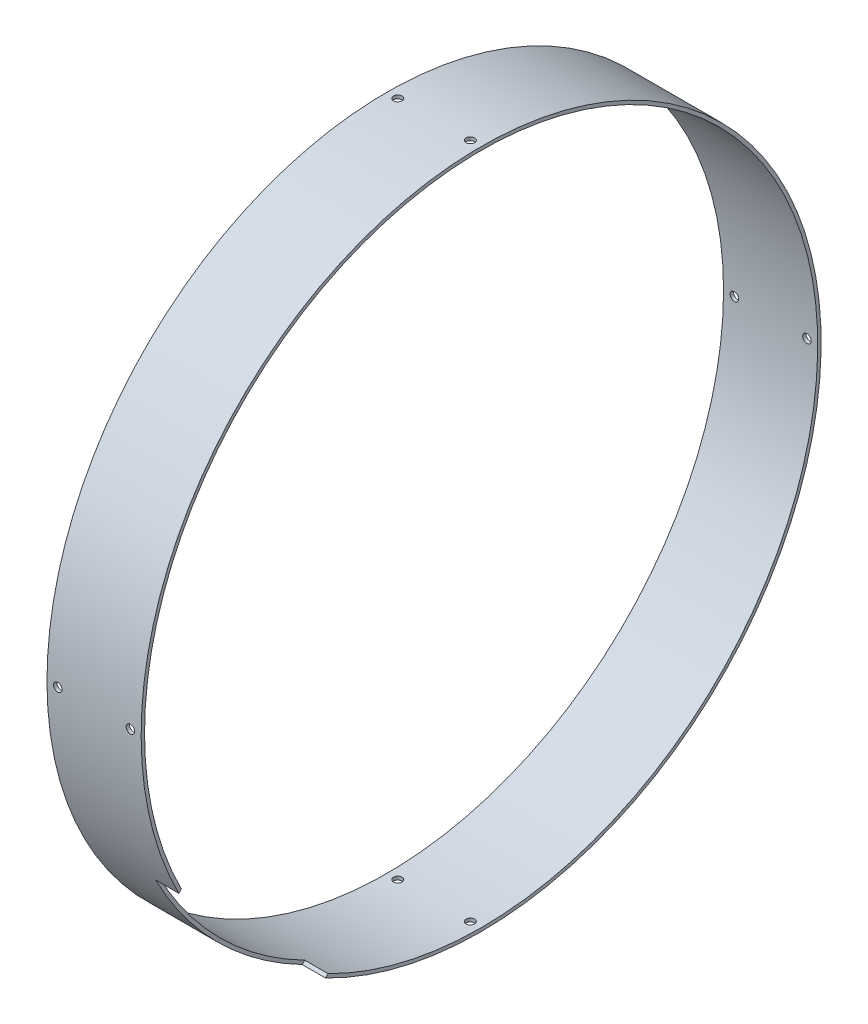
from build123d import *

# Parameters (mm, degrees)
SKETCH1_R             = 100
SKETCH1_R_2           = 99
BOSS_EXTRUDE1_DEPTH   = 27.7
F_2_5MM_DOWEL_HOLE1_D = 2.5
F_2_5MM_DOWEL_HOLE2_D = 2.5
SKETCH6_W             = 7.35
SKETCH6_H             = 61
CUT_EXTRUDE1_DEPTH    = 145.108605038


with BuildPart() as part:
    # Sketch1 → Boss-Extrude1 (new body)
    with BuildSketch(Plane(origin=(0, 0, 0), x_dir=(0, 0, -1), z_dir=(1, 0, 0))):
        Circle(SKETCH1_R)
        Circle(SKETCH1_R_2, mode=Mode.SUBTRACT)
    extrude(amount=BOSS_EXTRUDE1_DEPTH)

    # Ø2.5mm Dowel Hole1 (through all)
    with Locations(Plane.XY.offset(100)):
        with Locations((24.525, 0), (3.175, 0)):
            Hole(F_2_5MM_DOWEL_HOLE1_D / 2)

    # Ø2.5mm Dowel Hole2 (through all)
    with Locations(Plane(origin=(0, 100, 0), x_dir=(1, 0, 0), z_dir=(0, 1, 0))):
        with Locations((24.525, 0), (3.175, 0)):
            Hole(F_2_5MM_DOWEL_HOLE2_D / 2)

    # Sketch6 → Cut-Extrude1 (cut, through all)
    with BuildSketch(Plane(origin=(0, 0, 0), x_dir=(-1, 0, 0), z_dir=(0, 0.7071067811865475, -0.7071067811865477))):
        with Locations((-24.525, 0)):
            Rectangle(SKETCH6_W, SKETCH6_H)
    extrude(amount=-CUT_EXTRUDE1_DEPTH, mode=Mode.SUBTRACT)


solid = part.part
